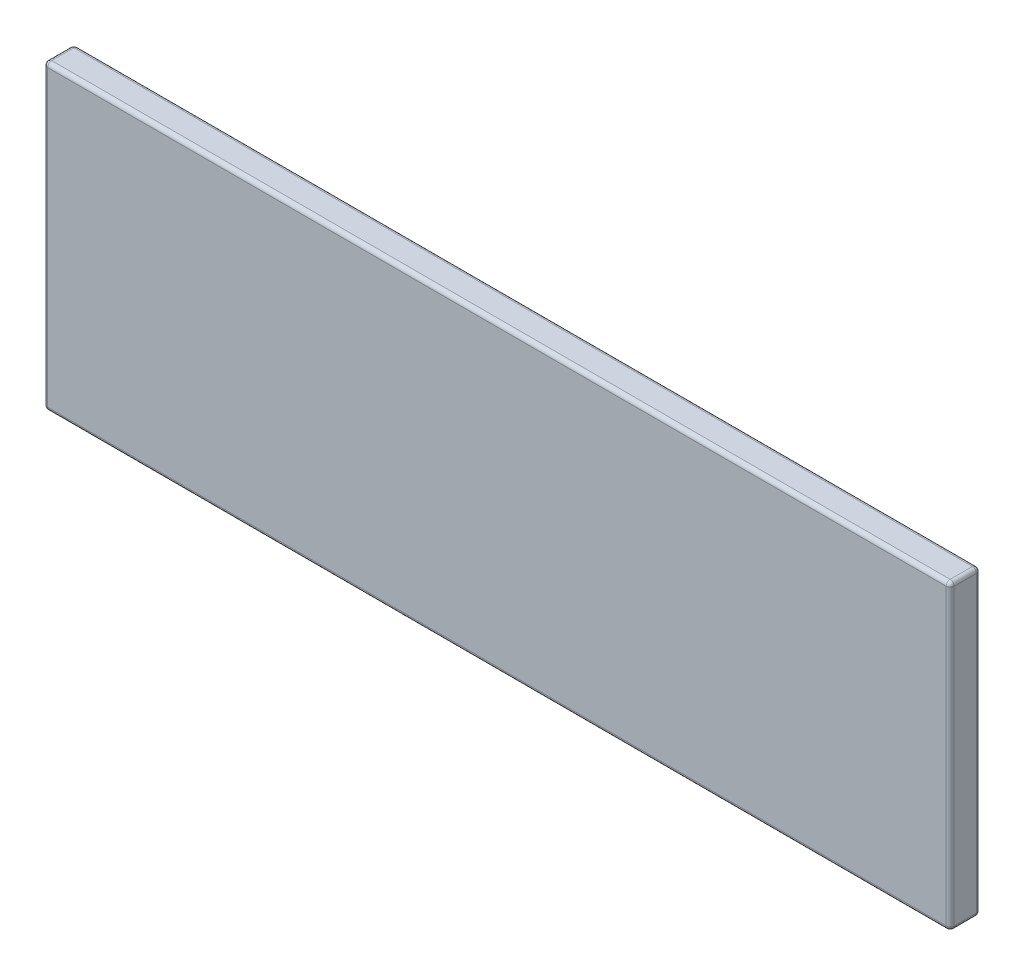
from build123d import *

# Parameters (mm, degrees)
SKETCH1_W           = 900
SKETCH1_H           = 300
BOSS_EXTRUDE1_DEPTH = 30
FILLET1_R           = 4
FILLET2_R           = 4
FILLET3_R           = 4


with BuildPart() as part:
    # Sketch1 → Boss-Extrude1 (new body)
    with BuildSketch(Plane.XY):
        with Locations((450, 150)):
            Rectangle(SKETCH1_W, SKETCH1_H)
    extrude(amount=BOSS_EXTRUDE1_DEPTH)

    # Fillet1
    fillet1_edges = [part.edges().sort_by_distance(p)[0] for p in [
        (900, 150, 30),
        (450, 300, 30),
        (0, 150, 30),
        (450, 0, 30),
    ]]
    fillet(fillet1_edges, radius=FILLET1_R)

    # Fillet2
    fillet2_edges = [part.edges().sort_by_distance(p)[0] for p in [
        (450, 300, 0),
        (900, 150, 0),
        (450, 0, 0),
        (0, 150, 0),
    ]]
    fillet(fillet2_edges, radius=FILLET2_R)

    # Fillet3
    # the kernel refuses this fillet: 4 mm, written as the material it takes off along each edge
    with BuildSketch(Plane(origin=(896, 4, 26), x_dir=(1, 0, 0), z_dir=(0, -1, 0))) as fillet3_piece_1_section:
        Polygon((0, 0), (FILLET3_R, 0), (FILLET3_R, FILLET3_R), (0, FILLET3_R), align=None)
    fillet3_piece_1 = extrude(amount=FILLET3_R, mode=Mode.PRIVATE)
    fillet3_piece_1 = fillet3_piece_1 - Plane(origin=(896, 4, 26), x_dir=(-0.7071067811865475, 0, -0.7071067811865475), z_dir=(0, -1, 0)) * Sphere(FILLET3_R, mode=Mode.PRIVATE)
    add(fillet3_piece_1, mode=Mode.SUBTRACT)
    with BuildSketch(Plane(origin=(4, 4, 26), x_dir=(-1, 0, 0), z_dir=(0, -1, 0))) as fillet3_piece_2_section:
        Polygon((0, 0), (FILLET3_R, 0), (FILLET3_R, -FILLET3_R), (0, -FILLET3_R), align=None)
    fillet3_piece_2 = extrude(amount=FILLET3_R, mode=Mode.PRIVATE)
    fillet3_piece_2 = fillet3_piece_2 - Plane(origin=(4, 4, 26), x_dir=(0.7071067811865475, 0, -0.7071067811865475), z_dir=(0, -1, 0)) * Sphere(FILLET3_R, mode=Mode.PRIVATE)
    add(fillet3_piece_2, mode=Mode.SUBTRACT)
    with BuildSketch(Plane(origin=(896, 296, 26), x_dir=(0, 1, 0), z_dir=(1, 0, 0))) as fillet3_piece_3_section:
        Polygon((0, 0), (FILLET3_R, 0), (FILLET3_R, FILLET3_R), (0, FILLET3_R), align=None)
    fillet3_piece_3 = extrude(amount=FILLET3_R, mode=Mode.PRIVATE)
    fillet3_piece_3 = fillet3_piece_3 - Plane(origin=(896, 296, 26), x_dir=(0, -0.7071067811865475, -0.7071067811865475), z_dir=(1, 0, 0)) * Sphere(FILLET3_R, mode=Mode.PRIVATE)
    add(fillet3_piece_3, mode=Mode.SUBTRACT)
    with BuildSketch(Plane(origin=(4, 296, 26), x_dir=(0, 1, 0), z_dir=(-1, 0, 0))) as fillet3_piece_4_section:
        Polygon((0, 0), (FILLET3_R, 0), (FILLET3_R, -FILLET3_R), (0, -FILLET3_R), align=None)
    fillet3_piece_4 = extrude(amount=FILLET3_R, mode=Mode.PRIVATE)
    fillet3_piece_4 = fillet3_piece_4 - Plane(origin=(4, 296, 26), x_dir=(0, -0.7071067811865475, -0.7071067811865475), z_dir=(-1, 0, 0)) * Sphere(FILLET3_R, mode=Mode.PRIVATE)
    add(fillet3_piece_4, mode=Mode.SUBTRACT)
    with BuildSketch(Plane(origin=(4, 296, 4), x_dir=(0, 1, 0), z_dir=(-1, 0, 0))) as fillet3_piece_5_section:
        Polygon((0, 0), (FILLET3_R, 0), (FILLET3_R, FILLET3_R), (0, FILLET3_R), align=None)
    fillet3_piece_5 = extrude(amount=FILLET3_R, mode=Mode.PRIVATE)
    fillet3_piece_5 = fillet3_piece_5 - Plane(origin=(4, 296, 4), x_dir=(0, -0.7071067811865475, 0.7071067811865475), z_dir=(-1, 0, 0)) * Sphere(FILLET3_R, mode=Mode.PRIVATE)
    add(fillet3_piece_5, mode=Mode.SUBTRACT)
    with BuildSketch(Plane(origin=(896, 296, 4), x_dir=(0, 1, 0), z_dir=(1, 0, 0))) as fillet3_piece_6_section:
        Polygon((0, 0), (FILLET3_R, 0), (FILLET3_R, -FILLET3_R), (0, -FILLET3_R), align=None)
    fillet3_piece_6 = extrude(amount=FILLET3_R, mode=Mode.PRIVATE)
    fillet3_piece_6 = fillet3_piece_6 - Plane(origin=(896, 296, 4), x_dir=(0, -0.7071067811865475, 0.7071067811865475), z_dir=(1, 0, 0)) * Sphere(FILLET3_R, mode=Mode.PRIVATE)
    add(fillet3_piece_6, mode=Mode.SUBTRACT)
    with BuildSketch(Plane(origin=(4, 4, 4), x_dir=(-1, 0, 0), z_dir=(0, -1, 0))) as fillet3_piece_7_section:
        Polygon((0, 0), (FILLET3_R, 0), (FILLET3_R, FILLET3_R), (0, FILLET3_R), align=None)
    fillet3_piece_7 = extrude(amount=FILLET3_R, mode=Mode.PRIVATE)
    fillet3_piece_7 = fillet3_piece_7 - Plane(origin=(4, 4, 4), x_dir=(0.7071067811865475, 0, 0.7071067811865475), z_dir=(0, -1, 0)) * Sphere(FILLET3_R, mode=Mode.PRIVATE)
    add(fillet3_piece_7, mode=Mode.SUBTRACT)
    with BuildSketch(Plane(origin=(896, 4, 4), x_dir=(1, 0, 0), z_dir=(0, -1, 0))) as fillet3_piece_8_section:
        Polygon((0, 0), (FILLET3_R, 0), (FILLET3_R, -FILLET3_R), (0, -FILLET3_R), align=None)
    fillet3_piece_8 = extrude(amount=FILLET3_R, mode=Mode.PRIVATE)
    fillet3_piece_8 = fillet3_piece_8 - Plane(origin=(896, 4, 4), x_dir=(-0.7071067811865475, 0, 0.7071067811865475), z_dir=(0, -1, 0)) * Sphere(FILLET3_R, mode=Mode.PRIVATE)
    add(fillet3_piece_8, mode=Mode.SUBTRACT)
    with BuildSketch(Plane(origin=(0, 300, 4), x_dir=(0, -1, 0), z_dir=(0, 0, 1)), Plane(origin=(0, 0, 4), x_dir=(1, 0, 0), z_dir=(0, 0, 1))) as fillet3_piece_9:
        with BuildLine():
            CenterArc((FILLET3_R, FILLET3_R), FILLET3_R, 180, 90)
            Line((0, FILLET3_R), (0, 0))
            Line((0, 0), (FILLET3_R, 0))
        make_face()
    extrude(amount=22, mode=Mode.SUBTRACT)
    with BuildSketch(Plane(origin=(900, 300, 4), x_dir=(0, -1, 0), z_dir=(0, 0, 1)), Plane(origin=(900, 0, 4), x_dir=(-1, 0, 0), z_dir=(0, 0, 1))) as fillet3_piece_10:
        with BuildLine():
            CenterArc((FILLET3_R, -FILLET3_R), FILLET3_R, 90, 90)
            Line((0, -FILLET3_R), (0, 0))
            Line((0, 0), (FILLET3_R, 0))
        make_face()
    extrude(amount=22, mode=Mode.SUBTRACT)


solid = part.part
